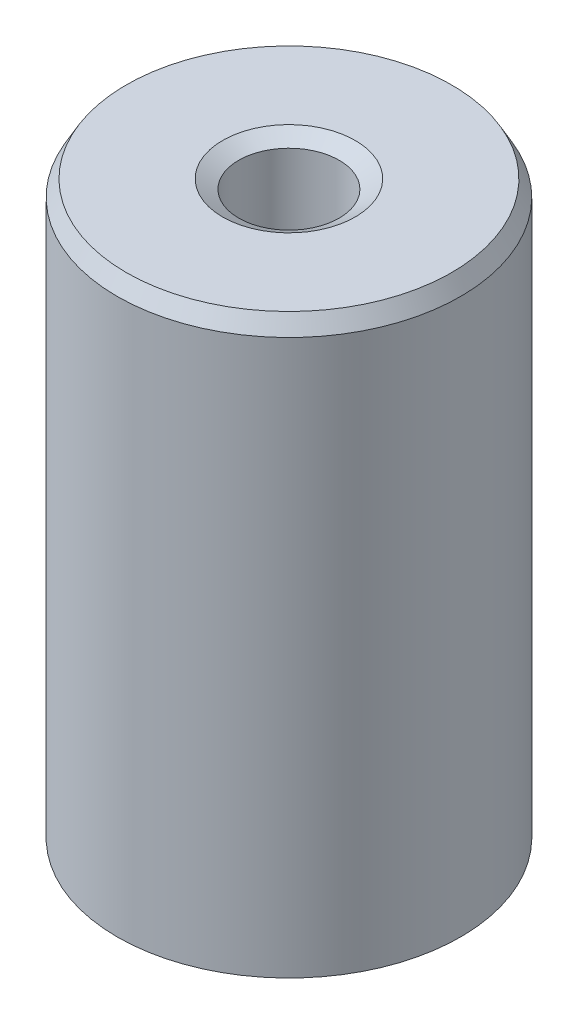
from build123d import *
from OCP.BRepFilletAPI import BRepFilletAPI_MakeChamfer

# Parameters (mm, degrees)
SKETCH1_R           = 5
BOSS_EXTRUDE1_DEPTH = 16.887398052
SKETCH2_R           = 1.461938325
CUT_EXTRUDE1_DEPTH  = 19.308036841
CHAMFER1_SIZE       = 0.469337473
CHAMFER1_SIZE2      = 0.263978847


with BuildPart() as part:
    # Sketch1 → Boss-Extrude1 (new body)
    with BuildSketch(Plane(origin=(0, 0, 0), x_dir=(1, 0, 0), z_dir=(0, 1, 0))):
        Circle(SKETCH1_R)
    extrude(amount=BOSS_EXTRUDE1_DEPTH)

    # Sketch2 → Cut-Extrude1 (cut, through all)
    with BuildSketch(Plane(origin=(0, 0, 0), x_dir=(1, 0, 0), z_dir=(0, 1, 0))):
        Circle(SKETCH2_R)
    extrude(amount=CUT_EXTRUDE1_DEPTH, mode=Mode.SUBTRACT)

    # Chamfer1: one chamfer whose edges measure the first distance from different faces: ONE call of the kernel's chamfer builder (chamfer() names one face for all edges)
    chamfer1_edges_1 = [part.edges().sort_by_distance(p)[0] for p in [
        (-1.461938325, 16.887398052, 0),
    ]]
    chamfer1_side_1 = [part.faces().sort_by_distance(p)[0] for p in [
        (-4.858578644, 16.887398052, 0),
    ]]
    chamfer1_edges_2 = [part.edges().sort_by_distance(p)[0] for p in [
        (-1.461938325, 0, 0),
    ]]
    chamfer1_side_2 = [part.faces().sort_by_distance(p)[0] for p in [
        (-1.461938325, 8.443699026, 0),
    ]]
    chamfer1_edges_3 = [part.edges().sort_by_distance(p)[0] for p in [
        (-5, 0, 0),
    ]]
    chamfer1_side_3 = [part.faces().sort_by_distance(p)[0] for p in [
        (-4.858578644, 0, 0),
    ]]
    chamfer1_edges_4 = [part.edges().sort_by_distance(p)[0] for p in [
        (-5, 16.887398052, 0),
    ]]
    chamfer1_side_4 = [part.faces().sort_by_distance(p)[0] for p in [
        (-5, 8.443699026, 0),
    ]]
    chamfer1 = BRepFilletAPI_MakeChamfer(part.part.solid().wrapped)
    for e in chamfer1_edges_1:
        chamfer1.Add(CHAMFER1_SIZE, CHAMFER1_SIZE2, e.wrapped, chamfer1_side_1[0].wrapped)  # the first distance lies on this face
    for e in chamfer1_edges_2:
        chamfer1.Add(CHAMFER1_SIZE, CHAMFER1_SIZE2, e.wrapped, chamfer1_side_2[0].wrapped)  # the first distance lies on this face
    for e in chamfer1_edges_3:
        chamfer1.Add(CHAMFER1_SIZE, CHAMFER1_SIZE2, e.wrapped, chamfer1_side_3[0].wrapped)  # the first distance lies on this face
    for e in chamfer1_edges_4:
        chamfer1.Add(CHAMFER1_SIZE, CHAMFER1_SIZE2, e.wrapped, chamfer1_side_4[0].wrapped)  # the first distance lies on this face
    add(Compound.cast(chamfer1.Shape()), mode=Mode.REPLACE)


solid = part.part
